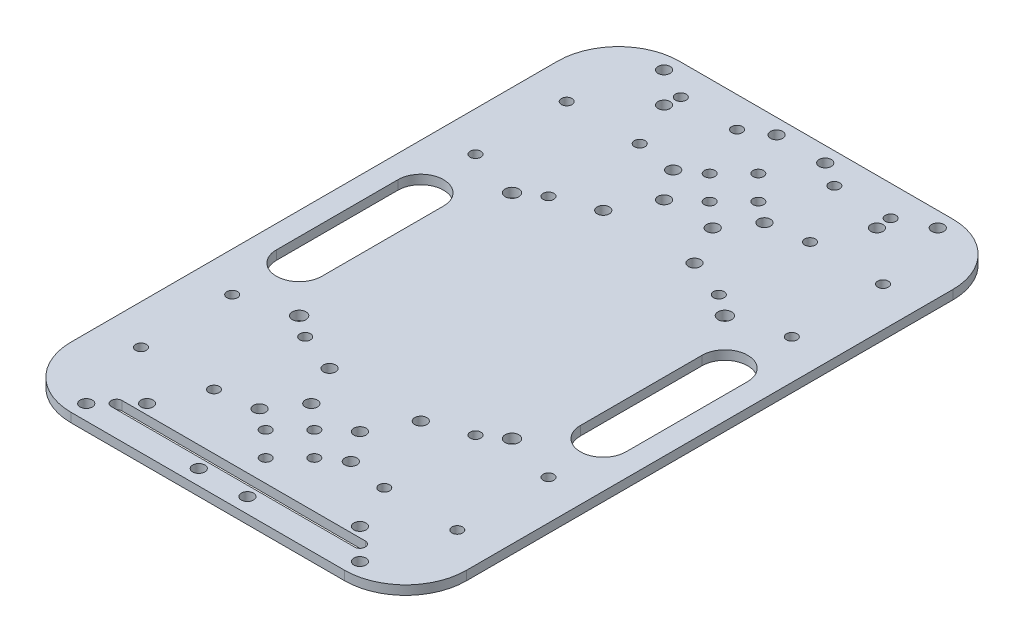
from build123d import *

# Parameters (mm, degrees)
SKETCH_1_W      = 130
SKETCH_1_H      = 200
SKETCH_1_R      = 1.75
SKETCH_1_R_2    = 2.25
SKETCH_1_R_3    = 2
EXTRUDE_2_DEPTH = 3
FILLET_1_R      = 20
FILLET_2_R      = 20
FILLET_3_R      = 20
FILLET_4_R      = 20


with BuildPart() as part:
    # 草图1 → 凸台-拉伸2 (new body)
    with BuildSketch(Plane(origin=(0, 0, 0), x_dir=(1, 0, 0), z_dir=(0, 1, 0))):
        Rectangle(SKETCH_1_W, SKETCH_1_H)
        with Locations((52, -70)):
            Circle(SKETCH_1_R, mode=Mode.SUBTRACT)
        with Locations((52, -40)):
            Circle(SKETCH_1_R, mode=Mode.SUBTRACT)
        with Locations((28, -40)):
            Circle(SKETCH_1_R, mode=Mode.SUBTRACT)
        with Locations((28, -70)):
            Circle(SKETCH_1_R, mode=Mode.SUBTRACT)
        with Locations((52, 40)):
            Circle(SKETCH_1_R, mode=Mode.SUBTRACT)
        with Locations((52, 70)):
            Circle(SKETCH_1_R, mode=Mode.SUBTRACT)
        with Locations((28, 70)):
            Circle(SKETCH_1_R, mode=Mode.SUBTRACT)
        with Locations((28, 40)):
            Circle(SKETCH_1_R, mode=Mode.SUBTRACT)
        with Locations((-28, 40)):
            Circle(SKETCH_1_R, mode=Mode.SUBTRACT)
        with Locations((-28, 70)):
            Circle(SKETCH_1_R, mode=Mode.SUBTRACT)
        with Locations((-52, 70)):
            Circle(SKETCH_1_R, mode=Mode.SUBTRACT)
        with Locations((-52, 40)):
            Circle(SKETCH_1_R, mode=Mode.SUBTRACT)
        with Locations((-28, -70)):
            Circle(SKETCH_1_R, mode=Mode.SUBTRACT)
        with Locations((-28, -40)):
            Circle(SKETCH_1_R, mode=Mode.SUBTRACT)
        with Locations((-52, -40)):
            Circle(SKETCH_1_R, mode=Mode.SUBTRACT)
        with Locations((-52, -70)):
            Circle(SKETCH_1_R, mode=Mode.SUBTRACT)
        with Locations((35, -35)):
            Circle(SKETCH_1_R_2, mode=Mode.SUBTRACT)
        with Locations((-35, -35)):
            Circle(SKETCH_1_R_2, mode=Mode.SUBTRACT)
        with Locations((-35, 35)):
            Circle(SKETCH_1_R_2, mode=Mode.SUBTRACT)
        with Locations((35, 35)):
            Circle(SKETCH_1_R_2, mode=Mode.SUBTRACT)
        with Locations((16, 90)):
            Circle(SKETCH_1_R, mode=Mode.SUBTRACT)
        with Locations((-16, 90)):
            Circle(SKETCH_1_R, mode=Mode.SUBTRACT)
        with Locations((-34.5, 90)):
            Circle(SKETCH_1_R, mode=Mode.SUBTRACT)
        with Locations((34.5, 90)):
            Circle(SKETCH_1_R, mode=Mode.SUBTRACT)
        with Locations((-8, 73)):
            Circle(SKETCH_1_R, mode=Mode.SUBTRACT)
        with Locations((0, 65)):
            Circle(SKETCH_1_R, mode=Mode.SUBTRACT)
        with Locations((0, 81)):
            Circle(SKETCH_1_R, mode=Mode.SUBTRACT)
        with Locations((8, 73)):
            Circle(SKETCH_1_R, mode=Mode.SUBTRACT)
        with Locations((-8, -73)):
            Circle(SKETCH_1_R, mode=Mode.SUBTRACT)
        with Locations((0, -81)):
            Circle(SKETCH_1_R, mode=Mode.SUBTRACT)
        with Locations((0, -65)):
            Circle(SKETCH_1_R, mode=Mode.SUBTRACT)
        with Locations((8, -73)):
            Circle(SKETCH_1_R, mode=Mode.SUBTRACT)
        with Locations((15, 45)):
            Circle(SKETCH_1_R_3, mode=Mode.SUBTRACT)
        with Locations((-15, 45)):
            Circle(SKETCH_1_R_3, mode=Mode.SUBTRACT)
        with Locations((-15, 68)):
            Circle(SKETCH_1_R_3, mode=Mode.SUBTRACT)
        with Locations((15, 68)):
            Circle(SKETCH_1_R_3, mode=Mode.SUBTRACT)
        with Locations((15, -68)):
            Circle(SKETCH_1_R_3, mode=Mode.SUBTRACT)
        with Locations((-15, -68)):
            Circle(SKETCH_1_R_3, mode=Mode.SUBTRACT)
        with Locations((-15, -45)):
            Circle(SKETCH_1_R_3, mode=Mode.SUBTRACT)
        with Locations((15, -45)):
            Circle(SKETCH_1_R_3, mode=Mode.SUBTRACT)
        with Locations((35, 85)):
            Circle(SKETCH_1_R_3, mode=Mode.SUBTRACT)
        with Locations((-35, 85)):
            Circle(SKETCH_1_R_3, mode=Mode.SUBTRACT)
        with Locations((35, -85)):
            Circle(SKETCH_1_R_3, mode=Mode.SUBTRACT)
        with Locations((-35, -85)):
            Circle(SKETCH_1_R_3, mode=Mode.SUBTRACT)
        with Locations((8, -58)):
            Circle(SKETCH_1_R_3, mode=Mode.SUBTRACT)
        with Locations((8, -95)):
            Circle(SKETCH_1_R_3, mode=Mode.SUBTRACT)
        with Locations((45, -95)):
            Circle(SKETCH_1_R_3, mode=Mode.SUBTRACT)
        with Locations((-45, -95)):
            Circle(SKETCH_1_R_3, mode=Mode.SUBTRACT)
        with Locations((-8, -95)):
            Circle(SKETCH_1_R_3, mode=Mode.SUBTRACT)
        with Locations((-8, -58)):
            Circle(SKETCH_1_R_3, mode=Mode.SUBTRACT)
        with Locations((45, 95)):
            Circle(SKETCH_1_R_3, mode=Mode.SUBTRACT)
        with Locations((8, 95)):
            Circle(SKETCH_1_R_3, mode=Mode.SUBTRACT)
        with Locations((-8, 95)):
            Circle(SKETCH_1_R_3, mode=Mode.SUBTRACT)
        with Locations((-45, 95)):
            Circle(SKETCH_1_R_3, mode=Mode.SUBTRACT)
        with Locations((8, 58)):
            Circle(SKETCH_1_R_3, mode=Mode.SUBTRACT)
        with Locations((-8, 58)):
            Circle(SKETCH_1_R_3, mode=Mode.SUBTRACT)
        with BuildLine():
            Line((-40, -88.25), (40, -88.25))
            ThreePointArc((40, -88.25), (41.75, -90), (40, -91.75))
            Line((40, -91.75), (-40, -91.75))
            ThreePointArc((-40, -91.75), (-41.75, -90), (-40, -88.25))
        make_face(mode=Mode.SUBTRACT)
        with BuildLine():
            Line((42.5, -20), (42.5, 20))
            ThreePointArc((42.5, 20), (50, 27.5), (57.5, 20))
            Line((57.5, 20), (57.5, -20))
            ThreePointArc((57.5, -20), (50, -27.5), (42.5, -20))
        make_face(mode=Mode.SUBTRACT)
        with BuildLine():
            Line((-57.5, -20), (-57.5, 20))
            ThreePointArc((-57.5, 20), (-50, 27.5), (-42.5, 20))
            Line((-42.5, 20), (-42.5, -20))
            ThreePointArc((-42.5, -20), (-50, -27.5), (-57.5, -20))
        make_face(mode=Mode.SUBTRACT)
    extrude(amount=EXTRUDE_2_DEPTH)

    # 圆角1
    fillet_1_edges = [part.edges().sort_by_distance(p)[0] for p in [
        (65, 1.5, 100),
    ]]
    fillet(fillet_1_edges, radius=FILLET_1_R)

    # 圆角2
    fillet_2_edges = [part.edges().sort_by_distance(p)[0] for p in [
        (-65, 1.5, 100),
    ]]
    fillet(fillet_2_edges, radius=FILLET_2_R)

    # 圆角3
    fillet_3_edges = [part.edges().sort_by_distance(p)[0] for p in [
        (-65, 1.5, -100),
    ]]
    fillet(fillet_3_edges, radius=FILLET_3_R)

    # 圆角4
    fillet_4_edges = [part.edges().sort_by_distance(p)[0] for p in [
        (65, 1.5, -100),
    ]]
    fillet(fillet_4_edges, radius=FILLET_4_R)


solid = part.part
